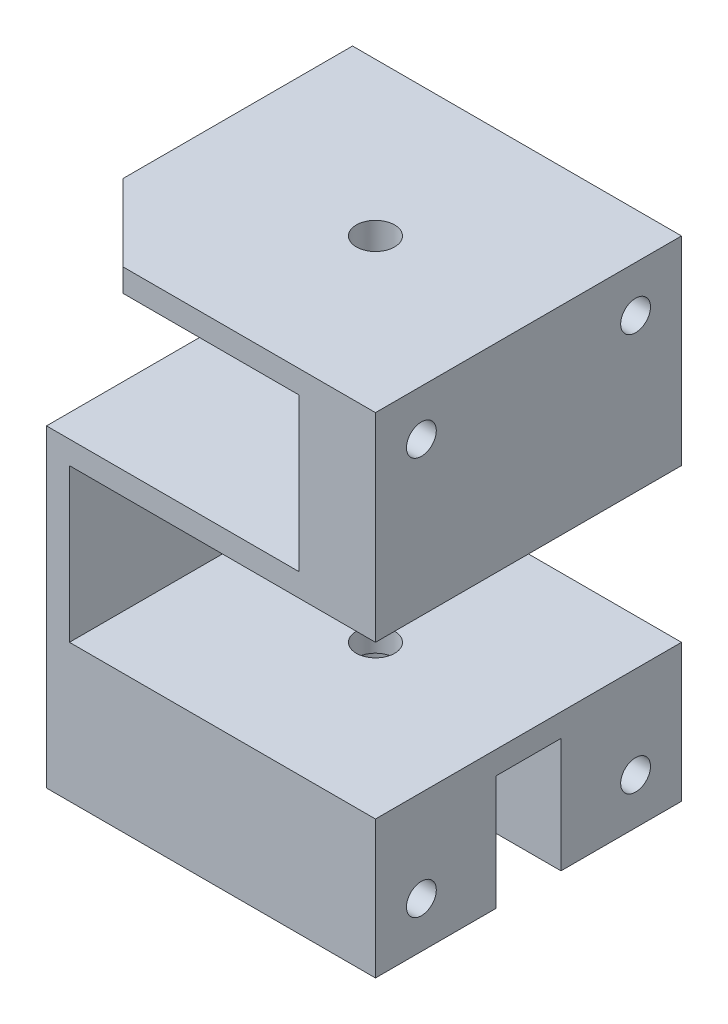
from build123d import *

# Parameters (mm, degrees)
BOSS_EXTRUDE1_DEPTH     = 40
CUT_EXTRUDE1_DEPTH      = 70.94998213
CUT_EXTRUDE1_DEPTH_BACK = 70.94998213
SKETCH3_R               = 2.5
CUT_EXTRUDE2_DEPTH      = 15
SKETCH5_R               = 3.5
SKETCH5_R_2             = 2.5
BOSS_EXTRUDE2_DEPTH     = 0.5
BOSS_EXTRUDE3_START     = 0.5
SKETCH6_R               = 3.5
SKETCH6_R_2             = 2.5
BOSS_EXTRUDE3_DEPTH     = 0.5
CHAMFER1_SIZE           = 0.5
CUT_EXTRUDE3_DEPTH      = 4.159338157
SKETCH9_W               = 43
SKETCH9_H               = 23
BOSS_EXTRUDE4_DEPTH     = 9
CHAMFER2_SIZE           = 3
SKETCH8_R               = 1.95
CUT_EXTRUDE4_DEPTH      = 9
CHAMFER5_SIZE           = 10


with BuildPart() as part:
    # Sketch1 → Boss-Extrude1 (new body)
    with BuildSketch(Plane.XY):
        Polygon((0, 0), (-40, 0), (-40, 20), (0, 20), (0, 46), (-43, 46), (-43, 43), (-10, 43), (-10, 23), (-43, 23), (-43, -18), (0, -18), align=None)
    extrude(amount=BOSS_EXTRUDE1_DEPTH)

    # Sketch3 → Cut-Extrude1 (cut, two sides: drawn at the far end of the back side and taken through both)
    with BuildSketch(Plane(origin=(0, 20, 0), x_dir=(-1, 0, 0), z_dir=(0, -1, 0)).offset(-CUT_EXTRUDE1_DEPTH_BACK)):
        with Locations(Location((20, -20, 0), (0, 0, 180))):
            Circle(SKETCH3_R)
    extrude(amount=CUT_EXTRUDE1_DEPTH + CUT_EXTRUDE1_DEPTH_BACK, mode=Mode.SUBTRACT)

    # Sketch4 → Cut-Extrude2 (cut)
    with BuildSketch(Plane(origin=(0, -18, 0), x_dir=(-1, 0, 0), z_dir=(0, -1, 0))):
        with BuildLine():
            Line((20, -24.25), (0, -24.25))
            Line((0, -24.25), (0, -15.75))
            Line((0, -15.75), (20, -15.75))
            ThreePointArc((20, -15.75), (24.25, -20), (20, -24.25))
        make_face()
    extrude(amount=-CUT_EXTRUDE2_DEPTH, mode=Mode.SUBTRACT)

    # Sketch5 → Boss-Extrude2 (add)
    with BuildSketch(Plane(origin=(0, 23, 0), x_dir=(1, 0, 0), z_dir=(0, 1, 0))):
        with Locations(Location((-20, -20, 0), (0, 0, 90))):
            Circle(SKETCH5_R)
        with Locations((-20, -20)):
            Circle(SKETCH5_R_2, mode=Mode.SUBTRACT)
    extrude(amount=BOSS_EXTRUDE2_DEPTH)

    # Sketch6 → Boss-Extrude3 (add)
    with BuildSketch(Plane(origin=(0, 43, 0), x_dir=(-1, 0, 0), z_dir=(0, -1, 0)).offset(BOSS_EXTRUDE3_START)):
        with Locations(Location((20, -20, 0), (0, 0, 90))):
            Circle(SKETCH6_R)
        with Locations(Location((20, -20, 0), (0, 0, 180))):
            Circle(SKETCH6_R_2, mode=Mode.SUBTRACT)
    extrude(amount=-BOSS_EXTRUDE3_DEPTH)

    # Chamfer1
    chamfer1_edges = [part.edges().sort_by_distance(p)[0] for p in [
        (-20, 23, 23.5),
        (-20, 43, 23.5),
    ]]
    chamfer(chamfer1_edges, length=CHAMFER1_SIZE - 0.0001)  # a hair under: the kernel refuses the full size

    # Sketch7 → Cut-Extrude3 (cut)
    with BuildSketch(Plane(origin=(-40, 0, 0), x_dir=(0, 0, -1), z_dir=(1, 0, 0))):
        with BuildLine():
            Line((-22.5, 12.25), (-17.5, 12.25))
            ThreePointArc((-17.5, 12.25), (-15.25, 10), (-17.5, 7.75))
            Line((-17.5, 7.75), (-22.5, 7.75))
            ThreePointArc((-22.5, 7.75), (-24.75, 10), (-22.5, 12.25))
        make_face()
    extrude(amount=-CUT_EXTRUDE3_DEPTH, mode=Mode.SUBTRACT)

    # Sketch9 → Boss-Extrude4 (add)
    with BuildSketch(Plane(origin=(0, 0, 0), x_dir=(-1, 0, 0), z_dir=(0, 0, -1))):
        with Locations((21.5, 34.5)):
            Rectangle(SKETCH9_W, SKETCH9_H)
    extrude(amount=-BOSS_EXTRUDE4_DEPTH)

    # Chamfer2
    chamfer2_edges = [part.edges().sort_by_distance(p)[0] for p in [
        (-10, 33, 9),
    ]]
    chamfer(chamfer2_edges, length=CHAMFER2_SIZE)

    # Sketch8 → Cut-Extrude4 (cut)
    with BuildSketch(Plane(origin=(0, 0, 0), x_dir=(0, 0, -1), z_dir=(1, 0, 0))):
        with Locations(Location((-34, 40, 0), (0, 0, 90))):
            Circle(SKETCH8_R)
        with Locations(Location((-6, 40, 0), (0, 0, 90))):
            Circle(SKETCH8_R)
        with Locations(Location((-34, -12, 0), (0, 0, 90))):
            Circle(SKETCH8_R)
        with Locations(Location((-6, -12, 0), (0, 0, 90))):
            Circle(SKETCH8_R)
    extrude(amount=-CUT_EXTRUDE4_DEPTH, mode=Mode.SUBTRACT)

    # Chamfer5
    chamfer5_edges = [part.edges().sort_by_distance(p)[0] for p in [
        (-43, 44.5, 40),
    ]]
    chamfer(chamfer5_edges, length=CHAMFER5_SIZE)


solid = part.part
